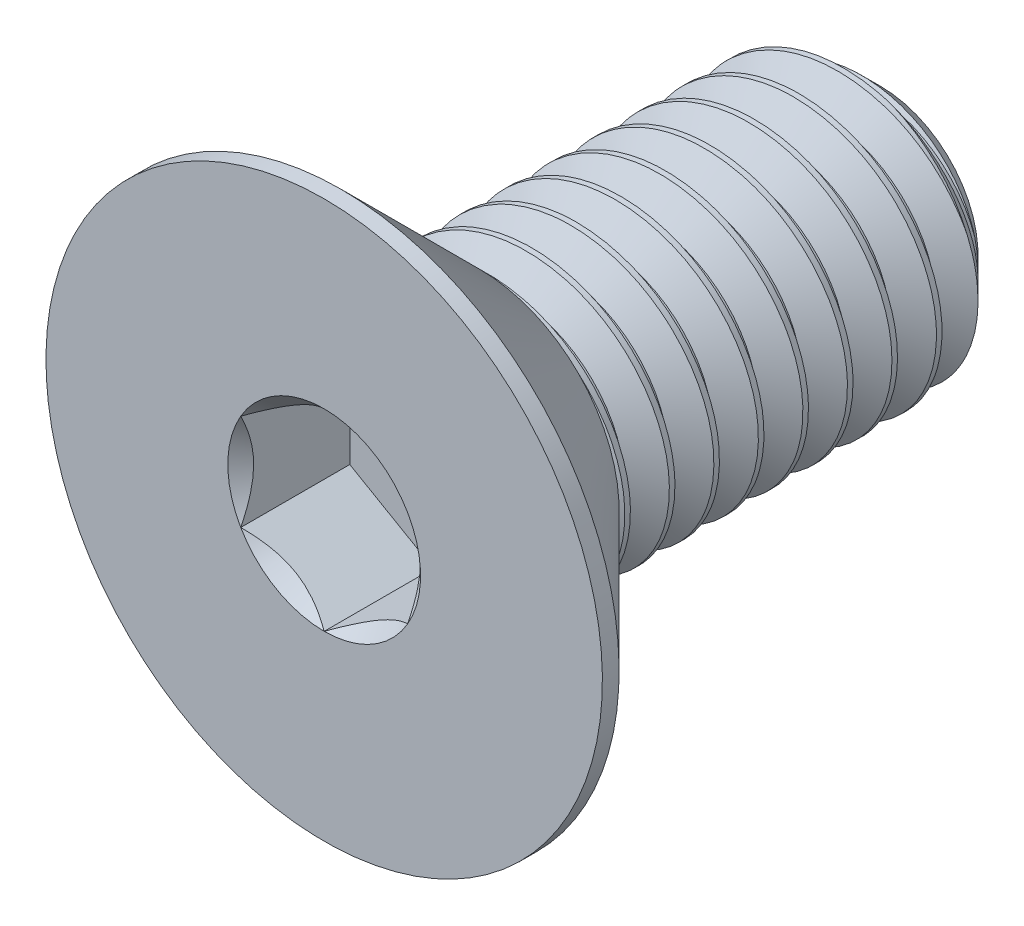
from build123d import *

# Parameters (mm, degrees)
SKETCH3_W          = 10
SKETCH3_H          = 2.5
CHAMFER1_SIZE      = 0.75
CUT_EXTRUDE1_DEPTH = 1.96
CUT_SWEEP1_PITCH   = 0.8
CUT_SWEEP1_TO      = 7.2


with BuildPart() as part:
    # Sketch3 → Revolve1 (revolve)
    with BuildSketch(Plane(origin=(0, 0, 0), x_dir=(0, 0, -1), z_dir=(1, 0, 0))):
        with Locations((0, 1.25)):
            Rectangle(SKETCH3_W, SKETCH3_H)
    revolve(axis=Axis((0, 0, -5), (0, 0, 1)))

    # Chamfer1
    chamfer1_edges = [part.edges().sort_by_distance(p)[0] for p in [
        (0, -2.5, -5),
    ]]
    chamfer(chamfer1_edges, length=CHAMFER1_SIZE)

    # Sketch6 → Revolve2 (revolve)
    with BuildSketch(Plane(origin=(0, 0, 0), x_dir=(0, 0, -1), z_dir=(1, 0, 0))):
        Polygon((-5, 5), (-4.7, 5), (-2.2, 2.5), (-2.2, 0), (-5, 0), align=None)
    revolve(axis=Axis((0, 0, -5), (0, 0, 1)))

    # Sketch8 → Cut-Extrude1 (cut)
    with BuildSketch(Plane.XY.offset(5)):
        Polygon((0, 1.732050808), (-1.5, 0.866025404), (-1.5, -0.866025404), (0, -1.732050808), (1.5, -0.866025404), (1.5, 0.866025404), align=None)
    extrude(amount=-CUT_EXTRUDE1_DEPTH, mode=Mode.SUBTRACT)

    # Cut-Extrude2 cone 1 section (through the dimple's axis) → Cut-Extrude2 (revolve, cut)
    with BuildSketch(Plane(origin=(0, 0, 5), x_dir=(0, -1, 0), z_dir=(1, 0, 0))):
        Polygon((0, 0), (1.732050808, 0), (0, 1.732050808), align=None)
    revolve(axis=Axis((0, 0, 5), (0, 0, -1)), mode=Mode.SUBTRACT)


with BuildPart() as body_2:
    # Split1: the piece on the far side of the plane
    add(part.part)
    split(bisect_by=Plane.XY.offset(2.2), keep=Keep.BOTTOM)

    # Cut-Sweep1: arcs per turn and ends read off the stored shape
    # Cut-Sweep1: the profile of Sketch10 screwed along a right-hand helix through 12.5 turns, 8 arcs to a turn; built about Z, then put on its axis
    cut_sweep1_z = Axis((0, 0, 0), (0, 0, 1))
    cut_sweep1_corners = [(2.54330127, 0, 0.025), (2.54330127, 0, -0.725), (1.980384758, 0, -0.4), (1.980384758, 0, -0.3)]
    with BuildLine(mode=Mode.PRIVATE) as cut_sweep1_profile:
        Line(cut_sweep1_corners[0], cut_sweep1_corners[1])
        Line(cut_sweep1_corners[1], cut_sweep1_corners[2])
        Line(cut_sweep1_corners[2], cut_sweep1_corners[3])
        Line(cut_sweep1_corners[3], cut_sweep1_corners[0])
    cut_sweep1_cap = Face(cut_sweep1_profile.wire())
    cut_sweep1_turn_angles = [0, 22.5, 45, 67.5, 90, 112.5, 135, 157.5, 180, 202.5, 225, 247.5, 270, 292.5, 315, 337.5, 360]
    cut_sweep1_turn_weights = [1, 0.9238795325112867, 1, 0.9238795325112867, 1, 0.9238795325112867, 1, 0.9238795325112867, 1, 0.9238795325112867, 1, 0.9238795325112867, 1, 0.9238795325112867, 1, 0.9238795325112867, 1]
    cut_sweep1_turn_rails = [Edge.make_bspline([Vector(p[0], p[1], 0).rotate(cut_sweep1_z, cut_sweep1_turn_angles[k]) / cut_sweep1_turn_weights[k] + Vector(0, 0, p[2] + CUT_SWEEP1_PITCH * cut_sweep1_turn_angles[k] / 360) for k in range(17)], [0, 0, 0, 1, 1, 2, 2, 3, 3, 4, 4, 5, 5, 6, 6, 7, 7, 8, 8, 8], 2, cut_sweep1_turn_weights) for p in cut_sweep1_corners]
    cut_sweep1_turn_sides = [Face.make_surface_from_curves(cut_sweep1_turn_rails[p[0]], cut_sweep1_turn_rails[p[1]]) for p in [(0, 1), (1, 2), (2, 3), (3, 0)]]
    cut_sweep1_last_angles = [4320, 4342.5, 4365, 4387.5, 4410, 4432.5, 4455, 4477.5, 4500]
    cut_sweep1_last_weights = [1, 0.9238795325112867, 1, 0.9238795325112867, 1, 0.9238795325112867, 1, 0.9238795325112685, 1]
    cut_sweep1_last_rails = [Edge.make_bspline([Vector(p[0], p[1], 0).rotate(cut_sweep1_z, cut_sweep1_last_angles[k]) / cut_sweep1_last_weights[k] + Vector(0, 0, p[2] + CUT_SWEEP1_PITCH * cut_sweep1_last_angles[k] / 360) for k in range(9)], [0, 0, 0, 1, 1, 2, 2, 3, 3, 4, 4, 4], 2, cut_sweep1_last_weights) for p in cut_sweep1_corners]
    cut_sweep1_last_sides = [Face.make_surface_from_curves(cut_sweep1_last_rails[p[0]], cut_sweep1_last_rails[p[1]]) for p in [(0, 1), (1, 2), (2, 3), (3, 0)]]
    cut_sweep1 = Plane(origin=(0, 0, -5), x_dir=(0, 1, 0), z_dir=(0, 0, 1)) * split(Solid(Shell([*[p.moved(Location((0, 0, CUT_SWEEP1_PITCH * i))) for i in range(12) for p in cut_sweep1_turn_sides], *cut_sweep1_last_sides, cut_sweep1_cap, cut_sweep1_cap.rotate(cut_sweep1_z, 4500).moved(Location((0, 0, CUT_SWEEP1_PITCH * 4500 / 360)))])), bisect_by=Plane.XY.offset(CUT_SWEEP1_TO), keep=Keep.BOTTOM, mode=Mode.PRIVATE)
    add(cut_sweep1, mode=Mode.SUBTRACT)


with BuildPart() as part_1:
    add(part.part)

    # Split1
    split(bisect_by=Plane.XY.offset(2.2), keep=Keep.TOP)


with BuildPart() as body_2_1:
    add(body_2.part)

    # Combine1: union part
    add(part_1.part)


solid = body_2_1.part
